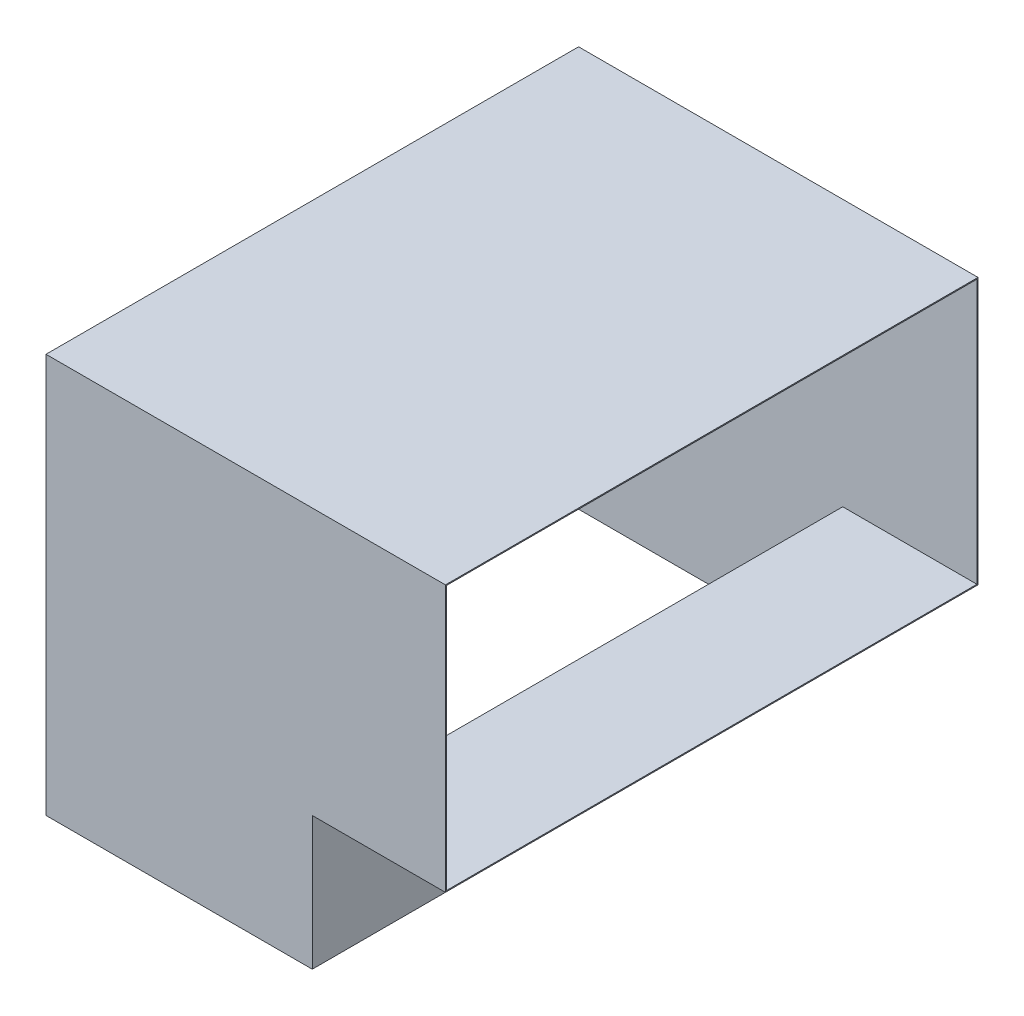
from build123d import *

# Parameters (mm, degrees)
EXTRUDE_THIN1_START       = -250
EXTRUDE_THIN1_OUTLINE_W   = 1000
EXTRUDE_THIN1_OUTLINE_H   = 500
EXTRUDE_THIN1_OUTLINE_W_2 = 996
EXTRUDE_THIN1_OUTLINE_H_2 = 496
EXTRUDE_THIN1_DEPTH       = 750
EXTRUDE_THIN2_START       = -498
SKETCH2_W                 = 500
SKETCH2_H                 = 1000
SKETCH2_W_2               = 496
SKETCH2_H_2               = 996
EXTRUDE_THIN2_DEPTH       = 748
CUT_EXTRUDE1_REACH        = 1032.776
SKETCH3_W                 = 496
SKETCH3_H                 = 996
CUT_EXTRUDE2_REACH        = 1032.776
SKETCH4_W                 = 996
SKETCH4_H                 = 496


# Read off the part's stored shape, not the designer's step: Extrude-Thin1
with BuildPart() as part:
    # Extrude-Thin1 outline → Extrude-Thin1 (new body)
    with BuildSketch(Plane(origin=(0, 0, 0), x_dir=(0, 0, -1), z_dir=(1, 0, 0)).offset(EXTRUDE_THIN1_START)):
        Rectangle(EXTRUDE_THIN1_OUTLINE_W, EXTRUDE_THIN1_OUTLINE_H)
        Rectangle(EXTRUDE_THIN1_OUTLINE_W_2, EXTRUDE_THIN1_OUTLINE_H_2, mode=Mode.SUBTRACT)
    extrude(amount=EXTRUDE_THIN1_DEPTH)

    # Sketch2 → Extrude-Thin2 (add)
    with BuildSketch(Plane.XZ.offset(250).offset(EXTRUDE_THIN2_START)):
        Rectangle(SKETCH2_W, SKETCH2_H)
        Rectangle(SKETCH2_W_2, SKETCH2_H_2, mode=Mode.SUBTRACT)
    extrude(amount=EXTRUDE_THIN2_DEPTH)

    # Sketch3 → Cut-Extrude1 (cut, up to next)
    with BuildSketch(Plane.XZ.offset(500), mode=Mode.PRIVATE) as cut_extrude1_sk1:
        Rectangle(SKETCH3_W, SKETCH3_H)
    cut_extrude1_tool1 = extrude(cut_extrude1_sk1.sketch, amount=-CUT_EXTRUDE1_REACH, mode=Mode.PRIVATE) & part.part
    add(cut_extrude1_tool1.solids().sort_by_distance((0, -500, 0))[0], mode=Mode.SUBTRACT)

    # Sketch4 → Cut-Extrude2 (cut, up to next)
    with BuildSketch(Plane(origin=(500, 0, 0), x_dir=(0, 0, -1), z_dir=(1, 0, 0)), mode=Mode.PRIVATE) as cut_extrude2_sk1:
        Rectangle(SKETCH4_W, SKETCH4_H)
    cut_extrude2_tool1 = extrude(cut_extrude2_sk1.sketch, amount=-CUT_EXTRUDE2_REACH, mode=Mode.PRIVATE) & part.part
    add(cut_extrude2_tool1.solids().sort_by_distance((500, 0, 0))[0], mode=Mode.SUBTRACT)


solid = part.part
